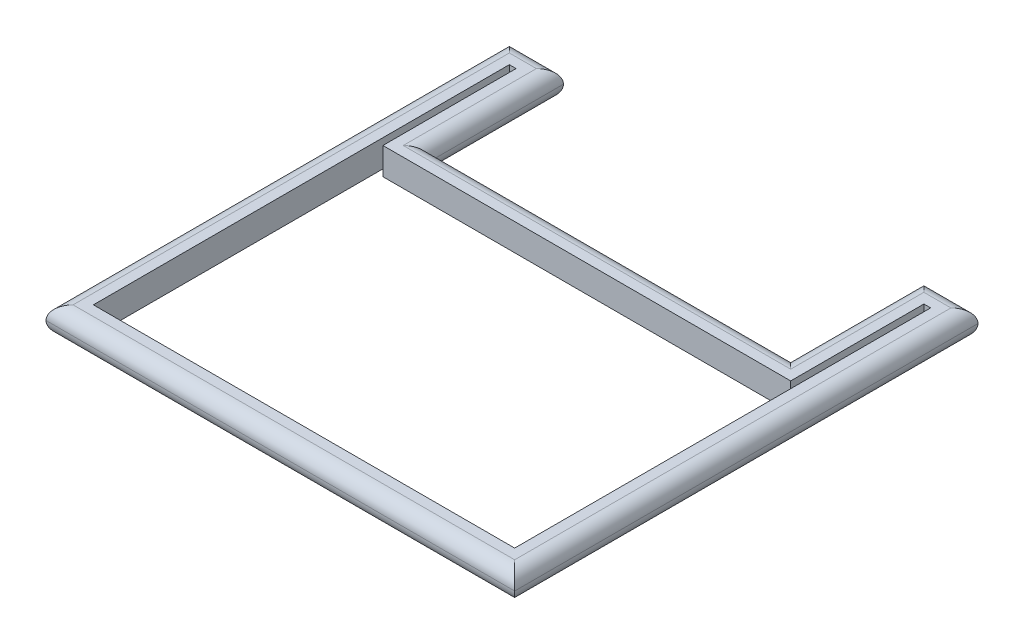
from build123d import *

# Parameters (mm, degrees)
BOSS_EXTRUDE1_DEPTH = 25.4
FILLET1_R           = 12.7


with BuildPart() as part:
    # Sketch2 → Boss-Extrude1 (new body)
    with BuildSketch(Plane(origin=(0, 0, 0), x_dir=(1, 0, 0), z_dir=(0, 1, 0))):
        Polygon((-219.925, -154.925), (219.925, -154.925), (219.925, 132.7), (219.925, 279.925000096), (169.125, 279.925000096), (169.125, 154.925), (-169.125, 154.925), (-169.125, 279.925000096), (-219.925, 279.925000096), (-219.925, 132.7), align=None)
        Polygon((-191.35, 132.7), (-191.35, 257.700000096), (-197.7, 257.700000096), (-197.7, 132.7), (-197.7, -132.7), (197.7, -132.7), (197.7, 132.7), (197.7, 257.700000096), (191.35, 257.700000096), (191.35, 132.7), align=None, mode=Mode.SUBTRACT)
    extrude(amount=BOSS_EXTRUDE1_DEPTH)

    # Fillet1
    fillet1_edges = [part.edges().sort_by_distance(p)[0] for p in [
        (0, 0, 154.925),
        (0, 25.4, 154.925),
        (-219.925, 0, -62.500000048),
        (-194.525, 0, -279.925000096),
        (-219.925, 25.4, -62.500000048),
        (-194.525, 25.4, -279.925000096),
        (-169.125, 0, -217.425000048),
        (-169.125, 25.4, -217.425000048),
        (0, 0, -154.925),
        (0, 25.4, -154.925),
        (219.925, 0, -62.500000048),
        (219.925, 25.4, -62.500000048),
        (194.525, 0, -279.925000096),
        (194.525, 25.4, -279.925000096),
        (169.125, 0, -217.425000048),
        (169.125, 25.4, -217.425000048),
    ]]
    fillet(fillet1_edges, radius=FILLET1_R - 0.0001)  # a hair under: the kernel refuses the full size


solid = part.part
